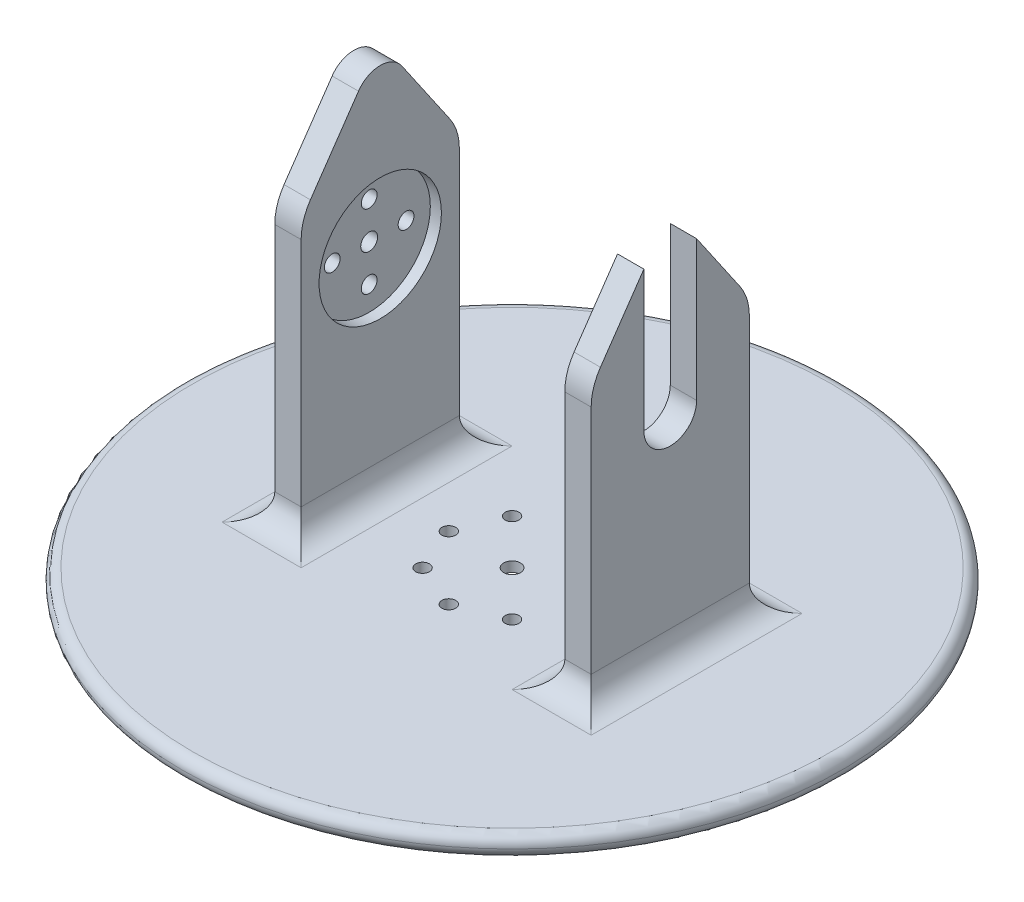
from build123d import *

# Parameters (mm, degrees)
SKETCH1_R           = 62.5
SKETCH1_R_2         = 1.3
SKETCH1_R_3         = 1.6
BOSS_EXTRUDE1_DEPTH = 4
FILLET3_R           = 2
SKETCH4_R           = 6.25
CUT_EXTRUDE3_DEPTH  = 2.1
SKETCH5_W           = 5
SKETCH5_H           = 30
BOSS_EXTRUDE2_DEPTH = 70
CUT_EXTRUDE4_START  = -5
CUT_EXTRUDE4_DEPTH  = 5
FILLET4_R           = 10
CUT_EXTRUDE5_START  = -5
CUT_EXTRUDE5_DEPTH  = 5
FILLET5_R           = 10
SKETCH13_R          = 11.6
CUT_EXTRUDE7_DEPTH  = 2.1
CUT_EXTRUDE8_REACH  = 133.949
SKETCH14_R          = 1.6
SKETCH14_R_2        = 1.5
CUT_EXTRUDE10_REACH = 114.75
SKETCH16_R          = 7.5
CUT_EXTRUDE11_REACH = 135.935
FILLET7_R           = 5


# Read off the part's stored shape, not the designer's step: Cut-Extrude4, Cut-Extrude5
with BuildPart() as part:
    # Sketch1 → Boss-Extrude1 (new body)
    with BuildSketch(Plane(origin=(0, 0, 0), x_dir=(1, 0, 0), z_dir=(0, 1, 0))):
        with Locations(Location((0, 0, 0), (0, 0, 270))):
            Circle(SKETCH1_R)
        with Locations(Location((-12, 0, 0), (0, 0, 270))):
            Circle(SKETCH1_R_2, mode=Mode.SUBTRACT)
        with Locations(Location((-8.485281374, 8.485281374, 0), (0, 0, 270))):
            Circle(SKETCH1_R_2, mode=Mode.SUBTRACT)
        with Locations(Location((0, 12, 0), (0, 0, 270))):
            Circle(SKETCH1_R_2, mode=Mode.SUBTRACT)
        with Locations(Location((8.485281374, 8.485281374, 0), (0, 0, 270))):
            Circle(SKETCH1_R_2, mode=Mode.SUBTRACT)
        with Locations(Location((12, 0, 0), (0, 0, 270))):
            Circle(SKETCH1_R_2, mode=Mode.SUBTRACT)
        with Locations(Location((8.485281374, -8.485281374, 0), (0, 0, 270))):
            Circle(SKETCH1_R_2, mode=Mode.SUBTRACT)
        with Locations(Location((0, -12, 0), (0, 0, 270))):
            Circle(SKETCH1_R_2, mode=Mode.SUBTRACT)
        with Locations(Location((-8.485281374, -8.485281374, 0), (0, 0, 270))):
            Circle(SKETCH1_R_2, mode=Mode.SUBTRACT)
        with Locations(Location((0, 0, 0), (0, 0, 270))):
            Circle(SKETCH1_R_3, mode=Mode.SUBTRACT)
    extrude(amount=BOSS_EXTRUDE1_DEPTH)

    # Fillet3
    fillet3_edges = [part.edges().sort_by_distance(p)[0] for p in [
        (0, 0, -62.5),
        (0, 4, -62.5),
    ]]
    fillet(fillet3_edges, radius=FILLET3_R - 0.0001)  # a hair under: the kernel refuses the full size

    # Sketch4 → Cut-Extrude3 (cut)
    with BuildSketch(Plane.XZ):
        with Locations(Location((0, 0, 0), (0, 0, 270))):
            Circle(SKETCH4_R)
    extrude(amount=-CUT_EXTRUDE3_DEPTH, mode=Mode.SUBTRACT)

    # Sketch5 → Boss-Extrude2 (add)
    with BuildSketch(Plane(origin=(0, 4, 0), x_dir=(1, 0, 0), z_dir=(0, 1, 0))):
        with Locations((-27.5, 0)):
            Rectangle(SKETCH5_W, SKETCH5_H)
        with Locations((27.5, 0)):
            Rectangle(SKETCH5_W, SKETCH5_H)
    extrude(amount=BOSS_EXTRUDE2_DEPTH)

    # Cut-Extrude4 outline → Cut-Extrude4 (cut)
    with BuildSketch(Plane(origin=(30, 0, 0), x_dir=(0, 0, -1), z_dir=(1, 0, 0)).offset(CUT_EXTRUDE4_START)):
        with BuildLine():
            Line((-15, 56), (-4.1208356, 71.831733384))
            ThreePointArc((-4.1208356, 71.831733384), (-2.328232471, 73.424854072), (4.9e-08, 74))
            Line((4.9e-08, 74), (-15, 74))
            Line((-15, 74), (-15, 56))
        make_face()
        with BuildLine():
            Line((15, 74), (4.9e-08, 74))
            ThreePointArc((4.9e-08, 74), (2.328232515, 73.424854049), (4.1208356, 71.831733384))
            Line((4.1208356, 71.831733384), (15, 56))
            Line((15, 56), (15, 74))
        make_face()
    extrude(amount=CUT_EXTRUDE4_DEPTH, mode=Mode.SUBTRACT)

    # Fillet4
    fillet4_edges = [part.edges().sort_by_distance(p)[0] for p in [
        (27.5, 56, 15),
        (27.5, 56, -15),
    ]]
    fillet(fillet4_edges, radius=FILLET4_R)

    # Cut-Extrude5 outline → Cut-Extrude5 (cut)
    with BuildSketch(Plane.ZY.offset(30).offset(CUT_EXTRUDE5_START)):
        with BuildLine():
            Line((-15, 56), (-4.1208356, 71.831733384))
            ThreePointArc((-4.1208356, 71.831733384), (-2.328232471, 73.424854072), (4.9e-08, 74))
            Line((4.9e-08, 74), (-15, 74))
            Line((-15, 74), (-15, 56))
        make_face()
        with BuildLine():
            Line((15, 74), (4.9e-08, 74))
            ThreePointArc((4.9e-08, 74), (2.328232515, 73.424854049), (4.1208356, 71.831733384))
            Line((4.1208356, 71.831733384), (15, 56))
            Line((15, 56), (15, 74))
        make_face()
    extrude(amount=CUT_EXTRUDE5_DEPTH, mode=Mode.SUBTRACT)

    # Fillet5
    fillet5_edges = [part.edges().sort_by_distance(p)[0] for p in [
        (-27.5, 56, -15),
        (-27.5, 56, 15),
    ]]
    fillet(fillet5_edges, radius=FILLET5_R)

    # Sketch13 → Cut-Extrude7 (cut)
    with BuildSketch(Plane(origin=(-25, 0, 0), x_dir=(0, 0, -1), z_dir=(1, 0, 0))):
        with Locations((0, 44)):
            Circle(SKETCH13_R)
    extrude(amount=-CUT_EXTRUDE7_DEPTH, mode=Mode.SUBTRACT)

    # Sketch14 → Cut-Extrude8 (cut, up to next)
    with BuildSketch(Plane(origin=(-27.1, 0, 0), x_dir=(0, 0, -1), z_dir=(1, 0, 0)), mode=Mode.PRIVATE) as cut_extrude8_sk1:
        with Locations((0, 44)):
            Circle(SKETCH14_R)
    cut_extrude8_tool1 = extrude(cut_extrude8_sk1.sketch, amount=-CUT_EXTRUDE8_REACH, mode=Mode.PRIVATE) & part.part
    # Sketch14 → Cut-Extrude8 (cut, up to next)
    with BuildSketch(Plane(origin=(-27.1, 0, 0), x_dir=(0, 0, -1), z_dir=(1, 0, 0)), mode=Mode.PRIVATE) as cut_extrude8_sk2:
        with Locations((0, 51)):
            Circle(SKETCH14_R_2)
    cut_extrude8_tool2 = extrude(cut_extrude8_sk2.sketch, amount=-CUT_EXTRUDE8_REACH, mode=Mode.PRIVATE) & part.part
    # Sketch14 → Cut-Extrude8 (cut, up to next)
    with BuildSketch(Plane(origin=(-27.1, 0, 0), x_dir=(0, 0, -1), z_dir=(1, 0, 0)), mode=Mode.PRIVATE) as cut_extrude8_sk3:
        with Locations((7, 44)):
            Circle(SKETCH14_R_2)
    cut_extrude8_tool3 = extrude(cut_extrude8_sk3.sketch, amount=-CUT_EXTRUDE8_REACH, mode=Mode.PRIVATE) & part.part
    # Sketch14 → Cut-Extrude8 (cut, up to next)
    with BuildSketch(Plane(origin=(-27.1, 0, 0), x_dir=(0, 0, -1), z_dir=(1, 0, 0)), mode=Mode.PRIVATE) as cut_extrude8_sk4:
        with Locations((0, 37)):
            Circle(SKETCH14_R_2)
    cut_extrude8_tool4 = extrude(cut_extrude8_sk4.sketch, amount=-CUT_EXTRUDE8_REACH, mode=Mode.PRIVATE) & part.part
    # Sketch14 → Cut-Extrude8 (cut, up to next)
    with BuildSketch(Plane(origin=(-27.1, 0, 0), x_dir=(0, 0, -1), z_dir=(1, 0, 0)), mode=Mode.PRIVATE) as cut_extrude8_sk5:
        with Locations((-7, 44)):
            Circle(SKETCH14_R_2)
    cut_extrude8_tool5 = extrude(cut_extrude8_sk5.sketch, amount=-CUT_EXTRUDE8_REACH, mode=Mode.PRIVATE) & part.part
    add(cut_extrude8_tool1.solids().sort_by_distance((-27.1, 44, 0))[0], mode=Mode.SUBTRACT)
    add(cut_extrude8_tool2.solids().sort_by_distance((-27.1, 51, 0))[0], mode=Mode.SUBTRACT)
    add(cut_extrude8_tool3.solids().sort_by_distance((-27.1, 44, -7))[0], mode=Mode.SUBTRACT)
    add(cut_extrude8_tool4.solids().sort_by_distance((-27.1, 37, 0))[0], mode=Mode.SUBTRACT)
    add(cut_extrude8_tool5.solids().sort_by_distance((-27.1, 44, 7))[0], mode=Mode.SUBTRACT)

    # Sketch16 → Cut-Extrude10 (cut, up to next)
    with BuildSketch(Plane(origin=(0, 4, 0), x_dir=(1, 0, 0), z_dir=(0, 1, 0)), mode=Mode.PRIVATE) as cut_extrude10_sk1:
        with Locations(Location((0, 30, 0), (0, 0, 270))):
            Circle(SKETCH16_R)
    cut_extrude10_tool1 = extrude(cut_extrude10_sk1.sketch, amount=-CUT_EXTRUDE10_REACH, mode=Mode.PRIVATE) & part.part
    add(cut_extrude10_tool1.solids().sort_by_distance((0, 4, -30))[0], mode=Mode.SUBTRACT)

    # Sketch18 → Cut-Extrude11 (cut, up to next)
    with BuildSketch(Plane(origin=(30, 0, 0), x_dir=(0, 0, -1), z_dir=(1, 0, 0)), mode=Mode.PRIVATE) as cut_extrude11_sk1:
        with BuildLine():
            Line((5, 74), (5, 44))
            ThreePointArc((5, 44), (0, 39), (-5, 44))
            Line((-5, 44), (-5, 74))
            ThreePointArc((-5, 74), (0, 79), (5, 74))
        make_face()
    cut_extrude11_tool1 = extrude(cut_extrude11_sk1.sketch, amount=-CUT_EXTRUDE11_REACH, mode=Mode.PRIVATE) & part.part
    add(cut_extrude11_tool1.solids().sort_by_distance((30, 59, 0))[0], mode=Mode.SUBTRACT)

    # Fillet7
    fillet7_edges = [part.edges().sort_by_distance(p)[0] for p in [
        (-25, 4, 0),
        (-27.5, 4, -15),
        (-30, 4, 0),
        (-27.5, 4, 15),
        (30, 4, 0),
        (27.5, 4, -15),
        (25, 4, 0),
        (27.5, 4, 15),
    ]]
    fillet(fillet7_edges, radius=FILLET7_R)


solid = part.part
